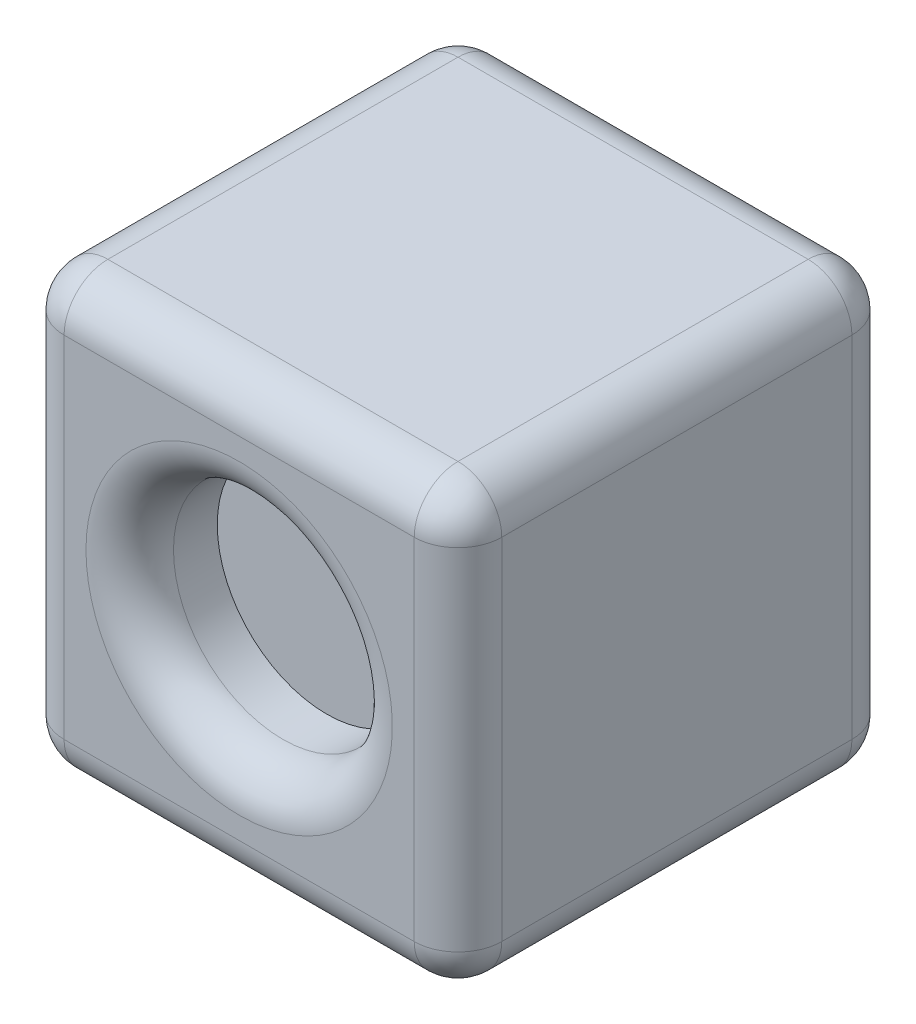
from build123d import *

# Parameters (mm, degrees)
SKETCH1_W           = 100
SKETCH1_H           = 100
BOSS_EXTRUDE1_DEPTH = 100
SKETCH2_R           = 25
CUT_EXTRUDE1_DEPTH  = 20
CUT_EXTRUDE3_DEPTH  = 20
CHAMFER1_SIZE       = 5
FILLET1_R           = 10
FILLET2_R           = 10
FILLET3_R           = 10


with BuildPart() as part:
    # Sketch1 → Boss-Extrude1 (new body)
    with BuildSketch(Plane.XY):
        Rectangle(SKETCH1_W, SKETCH1_H)
    extrude(amount=BOSS_EXTRUDE1_DEPTH)

    # Sketch2 → Cut-Extrude1 (cut)
    with BuildSketch(Plane.XY.offset(100)):
        Circle(SKETCH2_R)
    extrude(amount=-CUT_EXTRUDE1_DEPTH, mode=Mode.SUBTRACT)

    # Sketch6 → Cut-Extrude3 (cut)
    with BuildSketch(Plane.ZY.offset(50)):
        Polygon((69.019237886, -19.019237886), (30.980762114, 19.019237886), (24.019237886, 15), (24.019237886, -15), (50, -30), align=None)
        Polygon((50, 30), (30.980762114, 19.019237886), (69.019237886, -19.019237886), (75.980762114, -15), (75.980762114, 15), align=None)
    extrude(amount=-CUT_EXTRUDE3_DEPTH, mode=Mode.SUBTRACT)

    # Chamfer1
    chamfer1_edges = [part.edges().sort_by_distance(p)[0] for p in [
        (-50, -22.5, 37.009618943),
        (-50, -22.5, 62.990381057),
        (-50, 0, 75.980762114),
        (-50, 22.5, 62.990381057),
        (-50, 22.5, 37.009618943),
        (-50, 0, 24.019237886),
    ]]
    chamfer(chamfer1_edges, length=CHAMFER1_SIZE)

    # Fillet1
    fillet1_edges = [part.edges().sort_by_distance(p)[0] for p in [
        (-25, 0, 100),
    ]]
    fillet(fillet1_edges, radius=FILLET1_R)

    # Fillet2
    fillet2_edges = [part.edges().sort_by_distance(p)[0] for p in [
        (-50, 0, 100),
        (0, -50, 100),
        (0, -50, 0),
        (50, -50, 50),
        (-50, -50, 50),
        (-50, 50, 50),
        (0, 50, 100),
    ]]
    fillet(fillet2_edges, radius=FILLET2_R)

    # Fillet3
    # the kernel refuses this fillet: 10 mm, written as the material it takes off along each edge
    with BuildSketch(Plane(origin=(40, -40, 10), x_dir=(0, 0, -1), z_dir=(1, 0, 0))) as fillet3_piece_1_section:
        Polygon((0, 0), (FILLET3_R, 0), (FILLET3_R, -FILLET3_R), (0, -FILLET3_R), align=None)
    fillet3_piece_1 = extrude(amount=FILLET3_R, mode=Mode.PRIVATE)
    fillet3_piece_1 = fillet3_piece_1 - Plane(origin=(40, -40, 10), x_dir=(0, 0.7071067811865475, 0.7071067811865475), z_dir=(1, 0, 0)) * Sphere(FILLET3_R, mode=Mode.PRIVATE)
    add(fillet3_piece_1, mode=Mode.SUBTRACT)
    with BuildSketch(Plane(origin=(40, -40, 90), x_dir=(1, 0, 0), z_dir=(0, 0, 1))) as fillet3_piece_2_section:
        Polygon((0, 0), (FILLET3_R, 0), (FILLET3_R, -FILLET3_R), (0, -FILLET3_R), align=None)
    fillet3_piece_2 = extrude(amount=FILLET3_R, mode=Mode.PRIVATE)
    fillet3_piece_2 = fillet3_piece_2 - Plane(origin=(40, -40, 90), x_dir=(-0.7071067811865475, 0.7071067811865475, 0), z_dir=(0, 0, 1)) * Sphere(FILLET3_R, mode=Mode.PRIVATE)
    add(fillet3_piece_2, mode=Mode.SUBTRACT)
    with BuildSketch(Plane(origin=(-40, -40, 10), x_dir=(-1, 0, 0), z_dir=(0, 0, -1))) as fillet3_piece_3_section:
        Polygon((0, 0), (FILLET3_R, 0), (FILLET3_R, -FILLET3_R), (0, -FILLET3_R), align=None)
    fillet3_piece_3 = extrude(amount=FILLET3_R, mode=Mode.PRIVATE)
    fillet3_piece_3 = fillet3_piece_3 - Plane(origin=(-40, -40, 10), x_dir=(0.7071067811865475, 0.7071067811865475, 0), z_dir=(0, 0, -1)) * Sphere(FILLET3_R, mode=Mode.PRIVATE)
    add(fillet3_piece_3, mode=Mode.SUBTRACT)
    with BuildSketch(Plane(origin=(40, 40, 10), x_dir=(0, 1, 0), z_dir=(1, 0, 0))) as fillet3_piece_4_section:
        Polygon((0, 0), (FILLET3_R, 0), (FILLET3_R, -FILLET3_R), (0, -FILLET3_R), align=None)
    fillet3_piece_4 = extrude(amount=FILLET3_R, mode=Mode.PRIVATE)
    fillet3_piece_4 = fillet3_piece_4 - Plane(origin=(40, 40, 10), x_dir=(0, -0.7071067811865475, 0.7071067811865475), z_dir=(1, 0, 0)) * Sphere(FILLET3_R, mode=Mode.PRIVATE)
    add(fillet3_piece_4, mode=Mode.SUBTRACT)
    with BuildSketch(Plane(origin=(-45, -25.355339059, 75.980762114), x_dir=(-0.7071067811865476, 0, 0.7071067811865476), z_dir=(0, 1, 0))) as fillet3_piece_5_section:
        with BuildLine():
            CenterArc((FILLET3_R * 0.414213562373, FILLET3_R), FILLET3_R, 225, 45)
            Line((-FILLET3_R * 0.292893218813, FILLET3_R * 0.292893218813), (0, 0))
            Line((0, 0), (FILLET3_R * 0.414213562373, 0))
        make_face()
    fillet3_piece_5 = extrude(amount=50.710678119, mode=Mode.PRIVATE)
    fillet3_piece_5 = split(fillet3_piece_5, bisect_by=Plane(origin=(-43.280595019, -13.170460791, 75.710807016), z_dir=(0.7071067811865477, -0.6123724356957944, 0.35355339059327423)), keep=Keep.TOP, mode=Mode.PRIVATE)
    fillet3_piece_5 = split(fillet3_piece_5, bisect_by=Plane(origin=(-42.707460026, -14.659509184, 76.570509507), z_dir=(0, 0.8660254037844383, -0.5000000000000008)), keep=Keep.TOP, mode=Mode.PRIVATE)
    add(fillet3_piece_5, mode=Mode.SUBTRACT)
    with BuildSketch(Plane(origin=(-45, -25.355339059, 75.980762114), x_dir=(-0.7071067811865476, 0, 0.7071067811865476), z_dir=(0, 1, 0))) as fillet3_piece_6_section:
        with BuildLine():
            CenterArc((FILLET3_R * 0.414213562373, FILLET3_R), FILLET3_R, 225, 45)
            Line((-FILLET3_R * 0.292893218813, FILLET3_R * 0.292893218813), (0, 0))
            Line((0, 0), (FILLET3_R * 0.414213562373, 0))
        make_face()
    fillet3_piece_6 = extrude(amount=50.710678119, mode=Mode.PRIVATE)
    fillet3_piece_6 = split(fillet3_piece_6, bisect_by=Plane(origin=(-46.28634247, -15.385729384, 77.885344161), z_dir=(-0.7071067811865477, 0.6123724356957944, -0.35355339059327423)), keep=Keep.TOP, mode=Mode.PRIVATE)
    fillet3_piece_6 = split(fillet3_piece_6, bisect_by=Plane(origin=(-46.715123293, -14.271724128, 77.242172926), z_dir=(0, -0.8660254037844383, 0.5000000000000008)), keep=Keep.TOP, mode=Mode.PRIVATE)
    add(fillet3_piece_6, mode=Mode.SUBTRACT)
    with BuildSketch(Plane(origin=(-45, -25.355339059, 75.980762114), x_dir=(-0.7071067811865476, 0, 0.7071067811865476), z_dir=(0, 1, 0))) as fillet3_piece_7_section:
        with BuildLine():
            CenterArc((FILLET3_R * 0.414213562373, FILLET3_R), FILLET3_R, 225, 45)
            Line((-FILLET3_R * 0.292893218813, FILLET3_R * 0.292893218813), (0, 0))
            Line((0, 0), (FILLET3_R * 0.414213562373, 0))
        make_face()
    fillet3_piece_7 = extrude(amount=50.710678119, mode=Mode.PRIVATE)
    fillet3_piece_7 = split(fillet3_piece_7, bisect_by=Plane(origin=(-38.58008118, -5.415701855, 79.741415816), z_dir=(-0.7071067811865477, 0.6123724356957944, -0.35355339059327423)), keep=Keep.TOP, mode=Mode.PRIVATE)
    fillet3_piece_7 = split(fillet3_piece_7, bisect_by=Plane(origin=(-38.58008118, 5.415701855, 79.741415816), z_dir=(-0.7071067811865476, -0.6123724356957948, -0.3535533905932732)), keep=Keep.TOP, mode=Mode.PRIVATE)
    fillet3_piece_7 = split(fillet3_piece_7, bisect_by=Plane(origin=(-44.833595027, -10.975514643, 82.951375226), z_dir=(0, 0.8660254037844383, -0.5000000000000008)), keep=Keep.TOP, mode=Mode.PRIVATE)
    fillet3_piece_7 = split(fillet3_piece_7, bisect_by=Plane(origin=(-44.833595027, 10.975514643, 82.951375226), z_dir=(0, -0.8660254037844392, -0.49999999999999917)), keep=Keep.TOP, mode=Mode.PRIVATE)
    add(fillet3_piece_7, mode=Mode.SUBTRACT)
    with BuildSketch(Plane(origin=(-45, -25.355339059, 75.980762114), x_dir=(-0.7071067811865476, 0, 0.7071067811865476), z_dir=(0, 1, 0))) as fillet3_piece_8_section:
        with BuildLine():
            CenterArc((FILLET3_R * 0.414213562373, FILLET3_R), FILLET3_R, 225, 45)
            Line((-FILLET3_R * 0.292893218813, FILLET3_R * 0.292893218813), (0, 0))
            Line((0, 0), (FILLET3_R * 0.414213562373, 0))
        make_face()
    fillet3_piece_8 = extrude(amount=50.710678119, mode=Mode.PRIVATE)
    fillet3_piece_8 = split(fillet3_piece_8, bisect_by=Plane(origin=(-43.280595019, 13.170460791, 75.710807016), z_dir=(0.7071067811865476, 0.6123724356957948, 0.3535533905932732)), keep=Keep.TOP, mode=Mode.PRIVATE)
    fillet3_piece_8 = split(fillet3_piece_8, bisect_by=Plane(origin=(-42.707460026, 14.659509184, 76.570509507), z_dir=(0, -0.8660254037844392, -0.49999999999999917)), keep=Keep.TOP, mode=Mode.PRIVATE)
    add(fillet3_piece_8, mode=Mode.SUBTRACT)
    with BuildSketch(Plane(origin=(-45, -25.355339059, 75.980762114), x_dir=(-0.7071067811865476, 0, 0.7071067811865476), z_dir=(0, 1, 0))) as fillet3_piece_9_section:
        with BuildLine():
            CenterArc((FILLET3_R * 0.414213562373, FILLET3_R), FILLET3_R, 225, 45)
            Line((-FILLET3_R * 0.292893218813, FILLET3_R * 0.292893218813), (0, 0))
            Line((0, 0), (FILLET3_R * 0.414213562373, 0))
        make_face()
    fillet3_piece_9 = extrude(amount=50.710678119, mode=Mode.PRIVATE)
    fillet3_piece_9 = split(fillet3_piece_9, bisect_by=Plane(origin=(-46.28634247, 15.385729384, 77.885344161), z_dir=(-0.7071067811865476, -0.6123724356957948, -0.3535533905932732)), keep=Keep.TOP, mode=Mode.PRIVATE)
    fillet3_piece_9 = split(fillet3_piece_9, bisect_by=Plane(origin=(-46.715123293, 14.271724128, 77.242172926), z_dir=(0, 0.8660254037844392, 0.49999999999999917)), keep=Keep.TOP, mode=Mode.PRIVATE)
    add(fillet3_piece_9, mode=Mode.SUBTRACT)
    with BuildSketch(Plane(origin=(40, 50, 0), x_dir=(0, 0, 1), z_dir=(-1, 0, 0)), Plane(origin=(50, -40, 0), x_dir=(0, 0, 1), z_dir=(0, 1, 0)), Plane(origin=(50, 50, 10), x_dir=(0, -1, 0), z_dir=(0, 0, 1)), Plane(origin=(50, -40, 100), x_dir=(-1, 0, 0), z_dir=(0, 1, 0))) as fillet3_piece_10:
        with BuildLine():
            CenterArc((FILLET3_R, -FILLET3_R), FILLET3_R, 90, 90)
            Line((0, -FILLET3_R), (0, 0))
            Line((0, 0), (FILLET3_R, 0))
        make_face()
    extrude(amount=80, mode=Mode.SUBTRACT)
    with BuildSketch(Plane(origin=(-50, 40, 0), x_dir=(1, 0, 0), z_dir=(0, -1, 0))) as fillet3_piece_11:
        with BuildLine():
            CenterArc((FILLET3_R, FILLET3_R), FILLET3_R, 180, 90)
            Line((0, FILLET3_R), (0, 0))
            Line((0, 0), (FILLET3_R, 0))
        make_face()
    extrude(amount=80, mode=Mode.SUBTRACT)
    with BuildSketch(Plane(origin=(-40, 40, 0), x_dir=(-1, 0, 0), z_dir=(0, -1, 0))) as fillet3_piece_12:
        with BuildLine():
            CenterArc((10 - FILLET3_R, -FILLET3_R), FILLET3_R, 0, 90)
            Line((10, -FILLET3_R), (10, 0))
            Line((10, 0), (10 - FILLET3_R, 0))
        make_face()
    revolve(axis=Axis((-40, 40, 0), (0, 0, -1)), revolution_arc=90, mode=Mode.SUBTRACT)
    with BuildSketch(Plane(origin=(50, 40, 90), x_dir=(0, 0, 1), z_dir=(0, -1, 0))) as fillet3_piece_13:
        with BuildLine():
            CenterArc((10 - FILLET3_R, FILLET3_R), FILLET3_R, 270, 90)
            Line((10, FILLET3_R), (10, 0))
            Line((10, 0), (10 - FILLET3_R, 0))
        make_face()
    revolve(axis=Axis((50, 40, 90), (-1, 0, 0)), revolution_arc=90, mode=Mode.SUBTRACT)


solid = part.part
